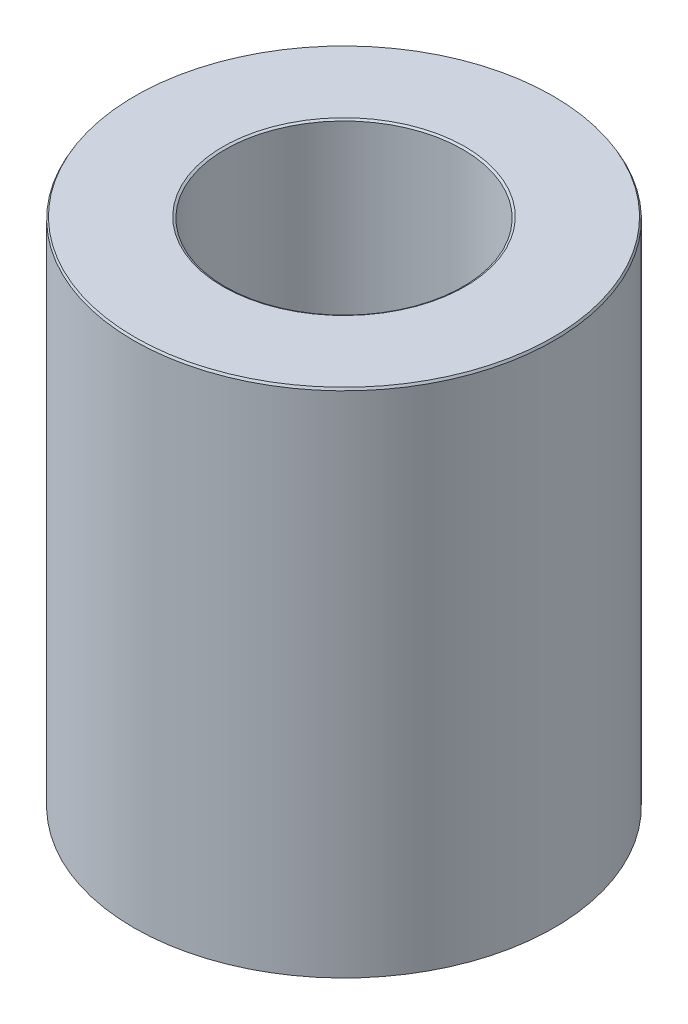
from build123d import *
from OCP.BRepFilletAPI import BRepFilletAPI_MakeChamfer

# Parameters (mm, degrees)
SKETCH1_R           = 50
BOSS_EXTRUDE1_DEPTH = 121.739695495
SKETCH2_R           = 28.277080817
CUT_EXTRUDE1_DEPTH  = 141.785487388
CHAMFER1_SIZE       = 0.523039949
CHAMFER1_SIZE2      = 0.301977255


with BuildPart() as part:
    # Sketch1 → Boss-Extrude1 (new body)
    with BuildSketch(Plane(origin=(0, 0, 0), x_dir=(1, 0, 0), z_dir=(0, 1, 0))):
        Circle(SKETCH1_R)
    extrude(amount=BOSS_EXTRUDE1_DEPTH)

    # Sketch2 → Cut-Extrude1 (cut, through all)
    with BuildSketch(Plane(origin=(0, 0, 0), x_dir=(1, 0, 0), z_dir=(0, 1, 0))):
        Circle(SKETCH2_R)
    extrude(amount=CUT_EXTRUDE1_DEPTH, mode=Mode.SUBTRACT)

    # Chamfer1: one chamfer whose edges measure the first distance from different faces: ONE call of the kernel's chamfer builder (chamfer() names one face for all edges)
    chamfer1_edges_1 = [part.edges().sort_by_distance(p)[0] for p in [
        (-28.277080817, 121.739695495, 0),
    ]]
    chamfer1_side_1 = [part.faces().sort_by_distance(p)[0] for p in [
        (-48.585786438, 121.739695495, 0),
    ]]
    chamfer1_edges_2 = [part.edges().sort_by_distance(p)[0] for p in [
        (-28.277080817, 0, 0),
    ]]
    chamfer1_side_2 = [part.faces().sort_by_distance(p)[0] for p in [
        (-28.277080817, 60.869847747, 0),
    ]]
    chamfer1_edges_3 = [part.edges().sort_by_distance(p)[0] for p in [
        (-50, 0, 0),
    ]]
    chamfer1_side_3 = [part.faces().sort_by_distance(p)[0] for p in [
        (-48.585786438, 0, 0),
    ]]
    chamfer1_edges_4 = [part.edges().sort_by_distance(p)[0] for p in [
        (-50, 121.739695495, 0),
    ]]
    chamfer1_side_4 = [part.faces().sort_by_distance(p)[0] for p in [
        (-50, 60.869847747, 0),
    ]]
    chamfer1 = BRepFilletAPI_MakeChamfer(part.part.solid().wrapped)
    for e in chamfer1_edges_1:
        chamfer1.Add(CHAMFER1_SIZE, CHAMFER1_SIZE2, e.wrapped, chamfer1_side_1[0].wrapped)  # the first distance lies on this face
    for e in chamfer1_edges_2:
        chamfer1.Add(CHAMFER1_SIZE, CHAMFER1_SIZE2, e.wrapped, chamfer1_side_2[0].wrapped)  # the first distance lies on this face
    for e in chamfer1_edges_3:
        chamfer1.Add(CHAMFER1_SIZE, CHAMFER1_SIZE2, e.wrapped, chamfer1_side_3[0].wrapped)  # the first distance lies on this face
    for e in chamfer1_edges_4:
        chamfer1.Add(CHAMFER1_SIZE, CHAMFER1_SIZE2, e.wrapped, chamfer1_side_4[0].wrapped)  # the first distance lies on this face
    add(Compound.cast(chamfer1.Shape()), mode=Mode.REPLACE)


solid = part.part
